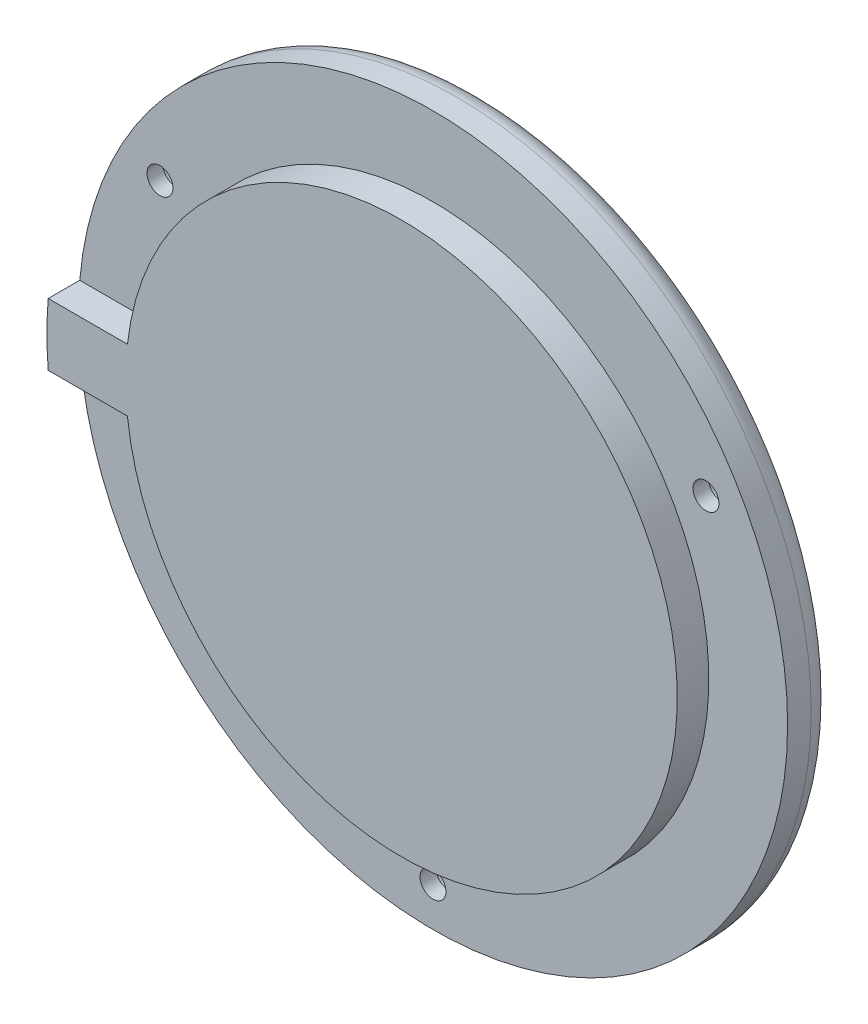
from build123d import *

# Parameters (mm, degrees)
ESBO_O1_R                = 45
RESSALTO_EXTRUS_O1_DEPTH = 6
RESSALTO_EXTRUS_O2_DEPTH = 4
ESBO_O4_R                = 1.65
CORTE_EXTRUS_O1_DEPTH    = 2
ESBO_O5_R                = 2.95
CORTE_EXTRUS_O2_DEPTH    = 4
FILETE1_R                = 3


with BuildPart() as part:
    # Esboço1 → Ressalto-extrusão1 (new body)
    with BuildSketch(Plane.XY):
        Circle(ESBO_O1_R)
    extrude(amount=RESSALTO_EXTRUS_O1_DEPTH)

    # Esboço3 → Ressalto-extrusão2 (add)
    with BuildSketch(Plane.XY.offset(6)):
        with BuildLine():
            Line((-34.776392855, 3.95), (-44.826303662, 3.95))
            ThreePointArc((-44.826303662, 3.95), (-45, 0), (-44.826303662, -3.95))
            Line((-44.826303662, -3.95), (-34.776392855, -3.95))
            ThreePointArc((-34.776392855, -3.95), (35, 0), (-34.776392855, 3.95))
        make_face()
    extrude(amount=RESSALTO_EXTRUS_O2_DEPTH)

    # Esboço4 → Corte-extrusão1 (cut)
    with BuildSketch(Plane.XY.offset(6)):
        with Locations((0, -40)):
            Circle(ESBO_O4_R)
        with Locations((-34.641016151, 20)):
            Circle(ESBO_O4_R)
        with Locations((34.641016151, 20)):
            Circle(ESBO_O4_R)
    extrude(amount=-CORTE_EXTRUS_O1_DEPTH, mode=Mode.SUBTRACT)

    # Esboço5 → Corte-extrusão2 (cut)
    with BuildSketch(Plane.XY.offset(4)):
        with Locations((0, -40)):
            Circle(ESBO_O5_R)
        with Locations((-34.641016151, 20)):
            Circle(ESBO_O5_R)
        with Locations((34.641016151, 20)):
            Circle(ESBO_O5_R)
    extrude(amount=-CORTE_EXTRUS_O2_DEPTH, mode=Mode.SUBTRACT)

    # Filete1
    # the kernel refuses this fillet: 3 mm, written as the material it takes off along each edge
    with BuildSketch(Plane(origin=(0, 0, 0), x_dir=(1, 0, 0), z_dir=(0, -1, 0))) as filete1_piece_1:
        with BuildLine():
            CenterArc((45 - FILETE1_R, FILETE1_R), FILETE1_R, 270, 90)
            Line((45 - FILETE1_R, 0), (45, 0))
            Line((45, 0), (45, FILETE1_R))
        make_face()
    revolve(axis=Axis((0, 0, 0), (0, 0, 1)), mode=Mode.SUBTRACT)


solid = part.part
